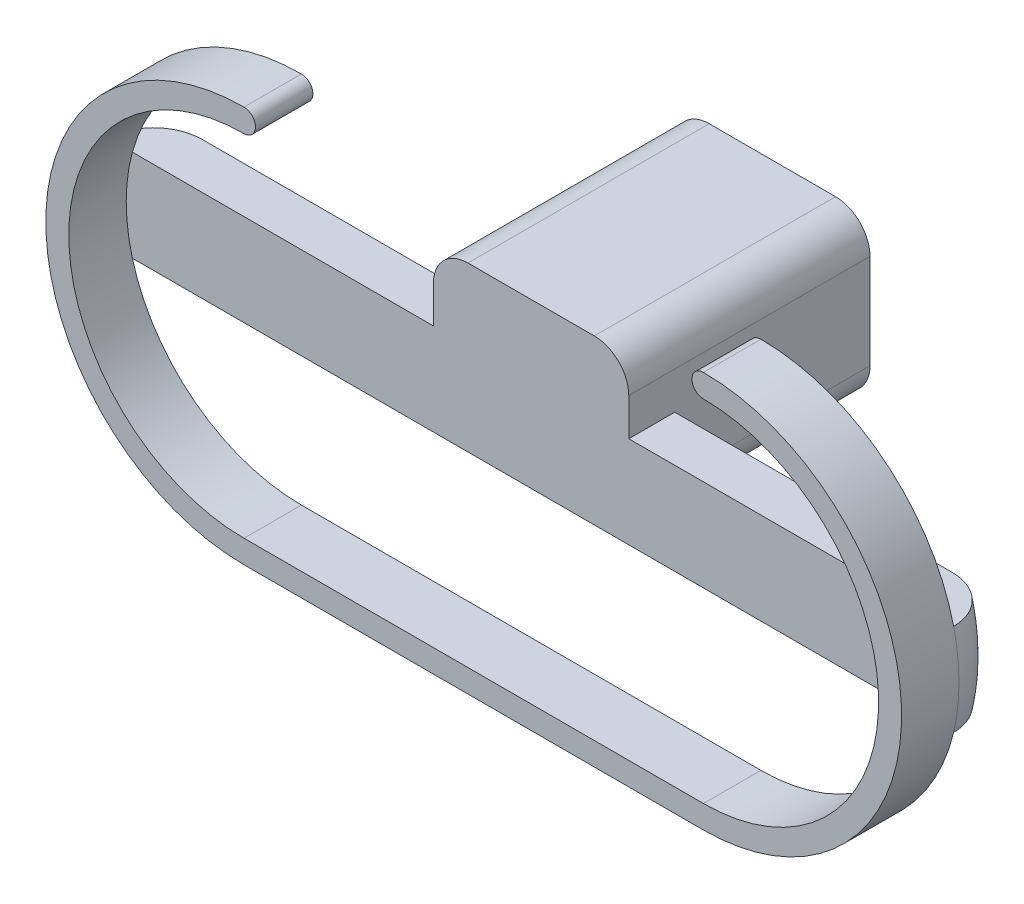
from build123d import *

# Parameters (mm, degrees)
BOSS_EXTRUDE1_DEPTH = 5
BOSS_EXTRUDE2_START = 4
BOSS_EXTRUDE2_DEPTH = 4
FILLET1_R           = 4
SKETCH5_W           = 17
SKETCH5_H           = 4
BOSS_EXTRUDE3_DEPTH = 6.25
SKETCH8_W           = 17
SKETCH8_H           = 14.25
BOSS_EXTRUDE4_DEPTH = 17
SKETCH6_R           = 1.5
CUT_EXTRUDE1_DEPTH  = 45.484596337
FILLET3_R           = 3


with BuildPart() as part:
    # Sketch3 → Boss-Extrude1 (new body)
    with BuildSketch(Plane.XY):
        with BuildLine():
            Line((-20, -17.25), (20, -17.25))
            ThreePointArc((20, -17.25), (37.25, 0), (20, 17.25))
            ThreePointArc((20, 17.25), (19, 16.25), (20, 15.25))
            ThreePointArc((20, 15.25), (35.25, 0), (20, -15.25))
            Line((20, -15.25), (-20, -15.25))
            ThreePointArc((-20, -15.25), (-35.25, 0), (-20, 15.25))
            ThreePointArc((-20, 15.25), (-19, 16.25), (-20, 17.25))
            ThreePointArc((-20, 17.25), (-37.25, 0), (-20, -17.25))
        make_face()
    extrude(amount=BOSS_EXTRUDE1_DEPTH)

    # Sketch4 → Boss-Extrude2 (add)
    with BuildSketch(Plane(origin=(0, 0, 0), x_dir=(-1, 0, 0), z_dir=(0, 0, -1)).offset(BOSS_EXTRUDE2_START)):
        with BuildLine():
            Line((-36.779824195, 4), (36.779824195, 4))
            ThreePointArc((36.779824195, 4), (37.313761542, 0), (36.779824195, -4))
            Line((36.779824195, -4), (-36.779824195, -4))
            ThreePointArc((-36.779824195, -4), (-37.25, 0), (-36.779824195, 4))
        make_face()
    extrude(amount=-BOSS_EXTRUDE2_DEPTH)

    # Fillet1
    fillet1_edges = [part.edges().sort_by_distance(p)[0] for p in [
        (-37.313761542, 0, -4),
        (37.25, 0, -4),
    ]]
    fillet(fillet1_edges, radius=FILLET1_R - 0.0001)  # a hair under: the kernel refuses the full size

    # Sketch5 → Boss-Extrude3 (add)
    with BuildSketch(Plane(origin=(0, 4, 0), x_dir=(1, 0, 0), z_dir=(0, 1, 0))):
        with Locations((0, 2)):
            Rectangle(SKETCH5_W, SKETCH5_H)
    extrude(amount=BOSS_EXTRUDE3_DEPTH)

    # Sketch8 → Boss-Extrude4 (add)
    with BuildSketch(Plane(origin=(0, 0, -4), x_dir=(-1, 0, 0), z_dir=(0, 0, -1))):
        with Locations((0, 3.125)):
            Rectangle(SKETCH8_W, SKETCH8_H)
    extrude(amount=BOSS_EXTRUDE4_DEPTH)

    # Sketch6 → Cut-Extrude1 (cut, through all)
    with BuildSketch(Plane(origin=(0, 0, -4), x_dir=(-1, 0, 0), z_dir=(0, 0, -1))):
        with Locations((-5.5, 7.125)):
            Circle(SKETCH6_R)
        with Locations((5.5, 7.125)):
            Circle(SKETCH6_R)
    extrude(amount=CUT_EXTRUDE1_DEPTH, mode=Mode.SUBTRACT)

    # Fillet3
    fillet3_edges = [part.edges().sort_by_distance(p)[0] for p in [
        (-8.5, 10.25, -10.5),
        (8.5, 10.25, -10.5),
        (8.5, -4, -12.5),
        (-8.5, -4, -12.5),
    ]]
    fillet(fillet3_edges, radius=FILLET3_R)


solid = part.part
